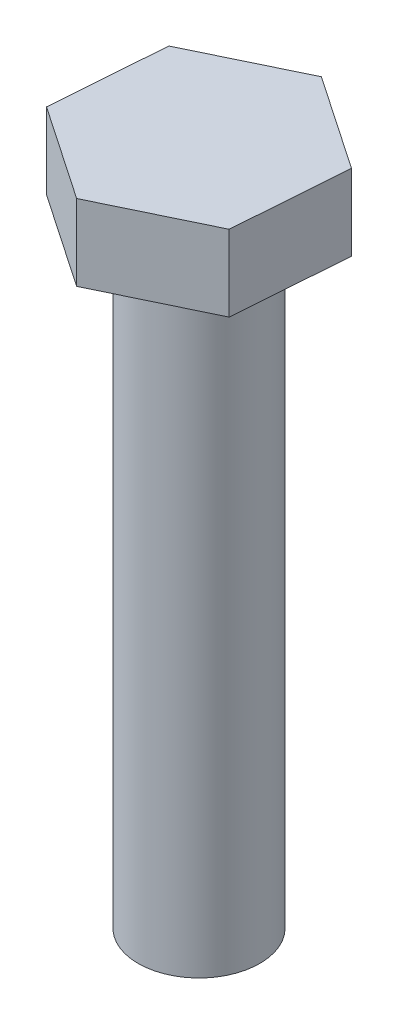
from build123d import *

# Parameters (mm, degrees)
SKETCH2_R           = 6.5
BOSS_EXTRUDE1_DEPTH = 5
SKETCH2_3_R         = 4
BOSS_EXTRUDE2_DEPTH = 40
BOSS_EXTRUDE3_DEPTH = 5


with BuildPart() as part:
    # Sketch2 → Boss-Extrude1 (new body)
    with BuildSketch(Plane(origin=(0, 0, 0), x_dir=(1, 0, 0), z_dir=(0, 1, 0))):
        Circle(SKETCH2_R)
    extrude(amount=BOSS_EXTRUDE1_DEPTH)

    # Sketch2<3> → Boss-Extrude2 (add)
    with BuildSketch(Plane(origin=(0, 0, 0), x_dir=(1, 0, 0), z_dir=(0, 1, 0))):
        Circle(SKETCH2_3_R)
    extrude(amount=-BOSS_EXTRUDE2_DEPTH)

    # Sketch3 → Boss-Extrude3 (add)
    with BuildSketch(Plane(origin=(0, 0, 0), x_dir=(1, 0, 0), z_dir=(0, 1, 0))):
        Polygon((-6.760475976, -3.260260405), (-0.556769654, -7.48487414), (6.203706322, -4.224613734), (6.760475976, 3.260260405), (0.556769654, 7.48487414), (-6.203706322, 4.224613734), align=None)
    extrude(amount=BOSS_EXTRUDE3_DEPTH)


solid = part.part
